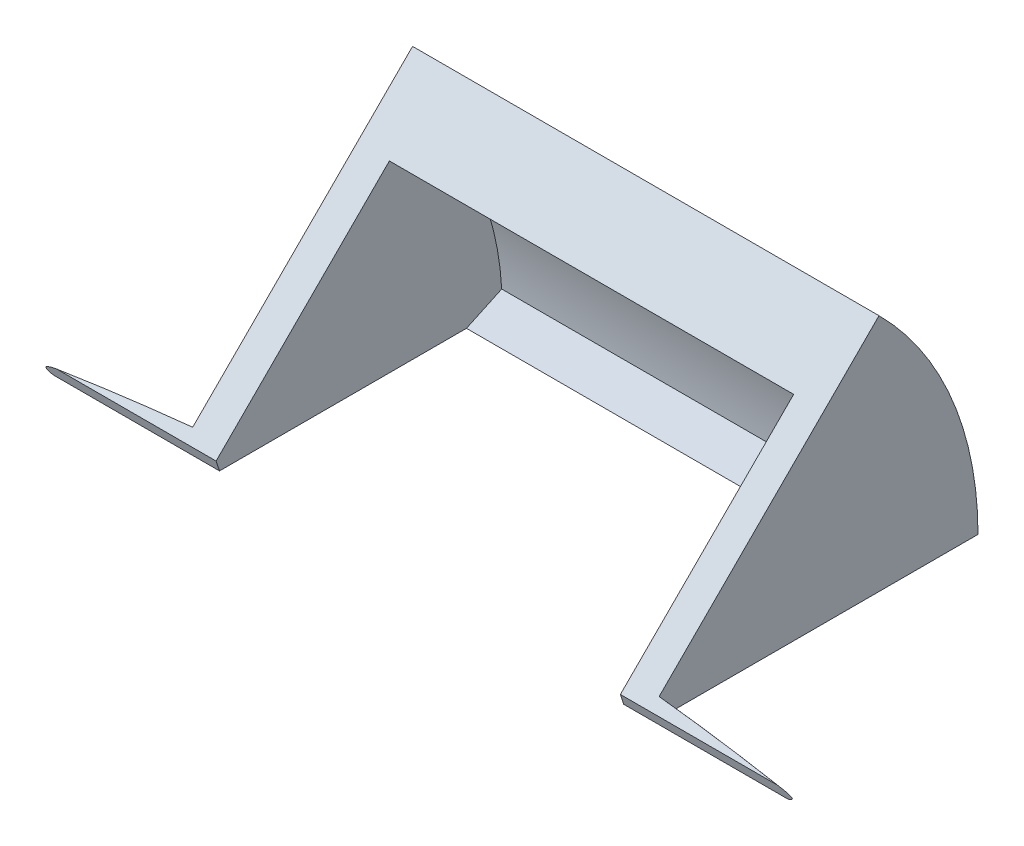
from build123d import *

# Parameters (mm, degrees)
REVOLVE1_ANGLE            = 45
CUT_REVOLVE_THIN3_START   = -65.672494398
CUT_REVOLVE_THIN3_DEPTH   = 132.08
CUT_REVOLVE_THIN3_START_2 = 59.247024
CUT_REVOLVE_THIN3_2_DEPTH = 7.160481602
EXTRUDE_THIN1_DEPTH       = 132.08
BOSS_EXTRUDE1_START       = 132.08
BOSS_EXTRUDE1_DEPTH       = 132.08
SKETCH12_R                = 990.316340453
CUT_EXTRUDE1_DEPTH        = 132.08
SKETCH14_W                = 3.086900102
SKETCH14_H                = 1.742063617
CUT_EXTRUDE5_DEPTH        = 2.54
SKETCH16_R                = 990.316340453
CUT_EXTRUDE6_DEPTH        = 351.028


# Read off the part's stored shape, not the designer's step: Cut-Revolve-Thin3
with BuildPart() as part:
    # Sketch1 → Revolve1 (revolve)
    with BuildSketch(Plane(origin=(0, 0, 0), x_dir=(1, 0, 0), z_dir=(0, 1, 0))):
        with BuildLine():
            Line((76.2, 994.033632479), (76.2, 1095.633632479))
            Line((76.2, 1095.633632479), (-76.2, 1095.633632479))
            Line((-76.2, 1095.633632479), (-76.2, 994.033632479))
            ThreePointArc((-76.2, 994.033632479), (-114.384675321, 990.366320384), (-152.4, 985.232735195))
            Line((-152.4, 985.232735195), (-102.9796946, 985.232735195))
            ThreePointArc((-102.9796946, 985.232735195), (0, 990.6), (102.9796946, 985.232735195))
            Line((102.9796946, 985.232735195), (152.4, 985.232735195))
            ThreePointArc((152.4, 985.232735195), (114.384675321, 990.366320384), (76.2, 994.033632479))
        make_face()
    revolve(axis=Axis((-102.9796946, 0, -985.232735195), (1, 0, 0)), revolution_arc=REVOLVE1_ANGLE)

    # Cut-Revolve-Thin3 outline → Cut-Revolve-Thin3 (cut)
    with BuildSketch(Plane.YZ.offset(CUT_REVOLVE_THIN3_START)):
        with BuildLine():
            ThreePointArc((0, -1082.04), (37.046536374, -1074.670985747), (68.453073412, -1053.685808607))
            Line((68.453073412, -1053.685808607), (2.371248163, -987.603983358))
            ThreePointArc((2.371248163, -987.603983358), (1.283310258, -988.330920225), (0, -988.586186506))
            Line((0, -988.586186506), (0, -1082.04))
        make_face()
    extrude(amount=CUT_REVOLVE_THIN3_DEPTH, mode=Mode.SUBTRACT)

    # Cut-Revolve-Thin3 2 outline → Cut-Revolve-Thin3 2 (cut)
    with BuildSketch(Plane.YZ.offset(CUT_REVOLVE_THIN3_START_2)):
        with BuildLine():
            ThreePointArc((0, -988.586186506), (1.283310258, -988.330920225), (2.371248163, -987.603983358))
            Line((2.371248163, -987.603983358), (2.337863382, -987.570598578))
            ThreePointArc((2.337863382, -987.570598578), (1.265242545, -988.287300908), (0, -988.538973298))
            Line((0, -988.538973298), (0, -988.586186506))
        make_face()
    extrude(amount=CUT_REVOLVE_THIN3_2_DEPTH, mode=Mode.SUBTRACT)

    # Sketch5 → Extrude-Thin1 (add)
    with BuildSketch(Plane(origin=(-65.672494398, 0, 0), x_dir=(0, 0, -1), z_dir=(1, 0, 0))):
        Polygon((1082.04, 0), (1070.380989237, 0), (1081.891098133, 5.367251924), (1082.964548518, 3.065230145), (1081.838188837, 2.54), (1082.04, 2.54), align=None)
    extrude(amount=EXTRUDE_THIN1_DEPTH)

    # Sketch11 → Boss-Extrude1 (add)
    with BuildSketch(Plane.ZY.offset(-66.407505602).offset(BOSS_EXTRUDE1_START)):
        with BuildLine():
            Line((-1053.685808607, 68.453073412), (-1045.195024303, 59.962289107))
            Line((-1045.195024303, 59.962289107), (-1056.738187334, 65.258078683))
            ThreePointArc((-1056.738187334, 65.258078683), (-1055.230229553, 66.872993821), (-1053.685808607, 68.453073412))
        make_face()
    extrude(amount=-BOSS_EXTRUDE1_DEPTH)

    # Sketch12 → Cut-Extrude1 (cut)
    with BuildSketch(Plane(origin=(-65.672494398, 0, 0), x_dir=(0, 0, -1), z_dir=(1, 0, 0))):
        with Locations((48.724048718, -308.713234064)):
            Circle(SKETCH12_R)
    extrude(amount=-CUT_EXTRUDE1_DEPTH, mode=Mode.SUBTRACT)


with BuildPart() as cut_extrude1_piece_1:
    # of the separate pieces the step leaves, piece 1, a body of its own (cut_extrude1_pieces)
    add(part.part.solids().sort_by_distance((152.4, 0, -985.232735195))[0])

    # Sketch16 → Cut-Extrude6 (cut)
    with BuildSketch(Plane(origin=(-65.672494398, 0, 0), x_dir=(0, 0, -1), z_dir=(1, 0, 0))):
        with Locations((48.724048718, -308.713234064)):
            Circle(SKETCH16_R)
    extrude(amount=CUT_EXTRUDE6_DEPTH, mode=Mode.SUBTRACT)


with BuildPart() as cut_extrude1_piece_2:
    # of the separate pieces the step leaves, piece 2, a body of its own (cut_extrude1_pieces)
    add(part.part.solids().sort_by_distance((-65.672494398, 0, -988.586186506))[0])

    # Sketch14 → Cut-Extrude5 (cut)
    with BuildSketch(Plane.XZ):
        with Locations((-64.129044347, -987.715154698)):
            Rectangle(SKETCH14_W, SKETCH14_H)
    extrude(amount=-CUT_EXTRUDE5_DEPTH, mode=Mode.SUBTRACT)


solid = cut_extrude1_piece_1.part
